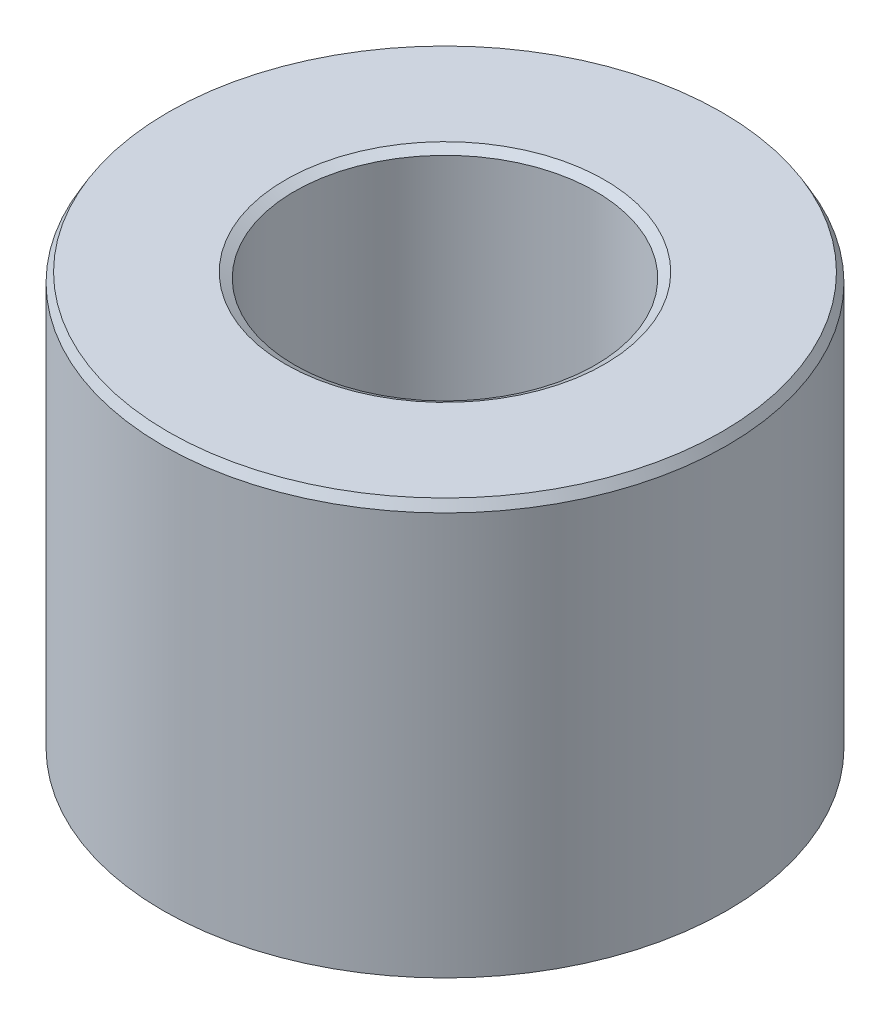
from build123d import *
from OCP.BRepFilletAPI import BRepFilletAPI_MakeChamfer

# Parameters (mm, degrees)
SKETCH1_R           = 40
BOSS_EXTRUDE1_DEPTH = 59.153175716
SKETCH2_R           = 21.331840043
CUT_EXTRUDE1_DEPTH  = 82.848018897
CHAMFER1_SIZE       = 1.303089297
CHAMFER1_SIZE2      = 0.752338957


with BuildPart() as part:
    # Sketch1 → Boss-Extrude1 (new body)
    with BuildSketch(Plane(origin=(0, 0, 0), x_dir=(1, 0, 0), z_dir=(0, 1, 0))):
        Circle(SKETCH1_R)
    extrude(amount=BOSS_EXTRUDE1_DEPTH)

    # Sketch2 → Cut-Extrude1 (cut, through all)
    with BuildSketch(Plane(origin=(0, 0, 0), x_dir=(1, 0, 0), z_dir=(0, 1, 0))):
        Circle(SKETCH2_R)
    extrude(amount=CUT_EXTRUDE1_DEPTH, mode=Mode.SUBTRACT)

    # Chamfer1: one chamfer whose edges measure the first distance from different faces: ONE call of the kernel's chamfer builder (chamfer() names one face for all edges)
    chamfer1_edges_1 = [part.edges().sort_by_distance(p)[0] for p in [
        (-21.331840043, 59.153175716, 0),
    ]]
    chamfer1_side_1 = [part.faces().sort_by_distance(p)[0] for p in [
        (-38.86862915, 59.153175716, 0),
    ]]
    chamfer1_edges_2 = [part.edges().sort_by_distance(p)[0] for p in [
        (-21.331840043, 0, 0),
    ]]
    chamfer1_side_2 = [part.faces().sort_by_distance(p)[0] for p in [
        (-21.331840043, 29.576587858, 0),
    ]]
    chamfer1_edges_3 = [part.edges().sort_by_distance(p)[0] for p in [
        (-40, 0, 0),
    ]]
    chamfer1_side_3 = [part.faces().sort_by_distance(p)[0] for p in [
        (-38.86862915, 0, 0),
    ]]
    chamfer1_edges_4 = [part.edges().sort_by_distance(p)[0] for p in [
        (-40, 59.153175716, 0),
    ]]
    chamfer1_side_4 = [part.faces().sort_by_distance(p)[0] for p in [
        (-40, 29.576587858, 0),
    ]]
    chamfer1 = BRepFilletAPI_MakeChamfer(part.part.solid().wrapped)
    for e in chamfer1_edges_1:
        chamfer1.Add(CHAMFER1_SIZE, CHAMFER1_SIZE2, e.wrapped, chamfer1_side_1[0].wrapped)  # the first distance lies on this face
    for e in chamfer1_edges_2:
        chamfer1.Add(CHAMFER1_SIZE, CHAMFER1_SIZE2, e.wrapped, chamfer1_side_2[0].wrapped)  # the first distance lies on this face
    for e in chamfer1_edges_3:
        chamfer1.Add(CHAMFER1_SIZE, CHAMFER1_SIZE2, e.wrapped, chamfer1_side_3[0].wrapped)  # the first distance lies on this face
    for e in chamfer1_edges_4:
        chamfer1.Add(CHAMFER1_SIZE, CHAMFER1_SIZE2, e.wrapped, chamfer1_side_4[0].wrapped)  # the first distance lies on this face
    add(Compound.cast(chamfer1.Shape()), mode=Mode.REPLACE)


solid = part.part
